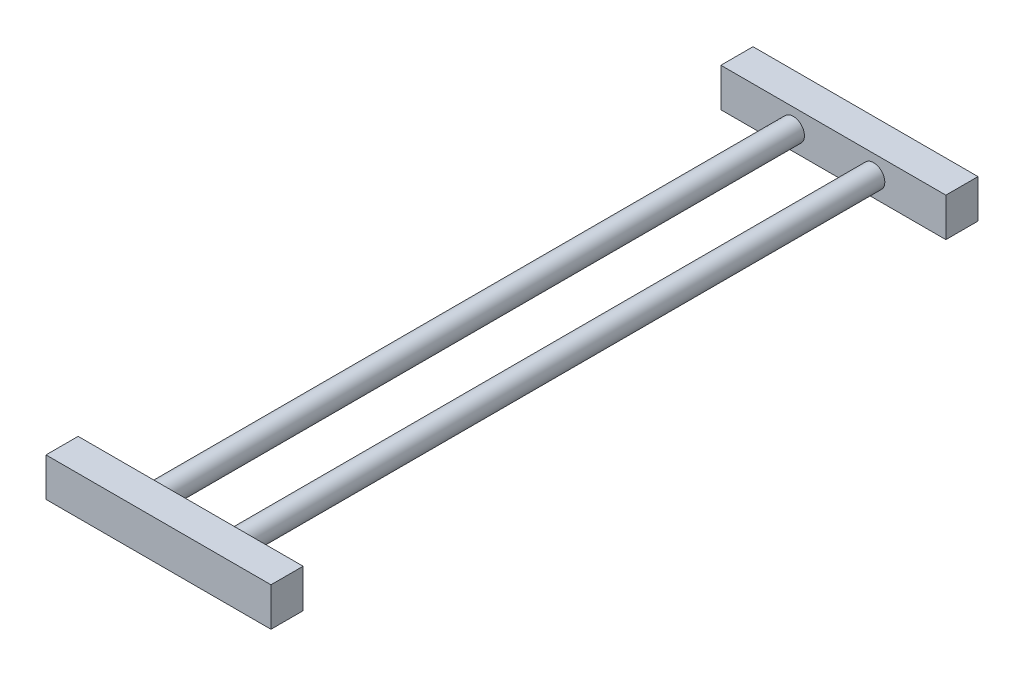
from build123d import *

# Parameters (mm, degrees)
ESQUISSE1_R          = 3.5
BOSS_EXTRU_1_DEPTH   = 200
BOSS_EXTRU_1_2_DEPTH = 200
ESQUISSE2_W          = 70
ESQUISSE2_H          = 12
BOSS_EXTRU_2_DEPTH   = 10
ESQUISSE3_W          = 70
ESQUISSE3_H          = 12
BOSS_EXTRU_3_DEPTH   = 10


with BuildPart() as part:
    # Esquisse1 → Boss.-Extru.1 (new body)
    with BuildSketch(Plane.XY):
        with Locations((-15.470635051, 10.736898533)):
            Circle(ESQUISSE1_R)
    extrude(amount=BOSS_EXTRU_1_DEPTH)



with BuildPart() as body_2:
    # Esquisse1 → Boss.-Extru.1 2 (new body)
    with BuildSketch(Plane.XY):
        with Locations((9.529364949, 10.736898533)):
            Circle(ESQUISSE1_R)
    extrude(amount=BOSS_EXTRU_1_2_DEPTH)


with BuildPart() as part_1:
    add(part.part)

    add(body_2.part)  # Boss.-Extru.2 merges body 2
    # Esquisse2 → Boss.-Extru.2 (add)
    with BuildSketch(Plane(origin=(0, 0, 0), x_dir=(-1, 0, 0), z_dir=(0, 0, -1))):
        with Locations((2.970635051, 10.736898533)):
            Rectangle(ESQUISSE2_W, ESQUISSE2_H)
    extrude(amount=BOSS_EXTRU_2_DEPTH)

    # Esquisse3 → Boss.-Extru.3 (add)
    with BuildSketch(Plane.XY.offset(200)):
        with Locations((-2.970635051, 10.736898533)):
            Rectangle(ESQUISSE3_W, ESQUISSE3_H)
    extrude(amount=BOSS_EXTRU_3_DEPTH)


solid = part_1.part
